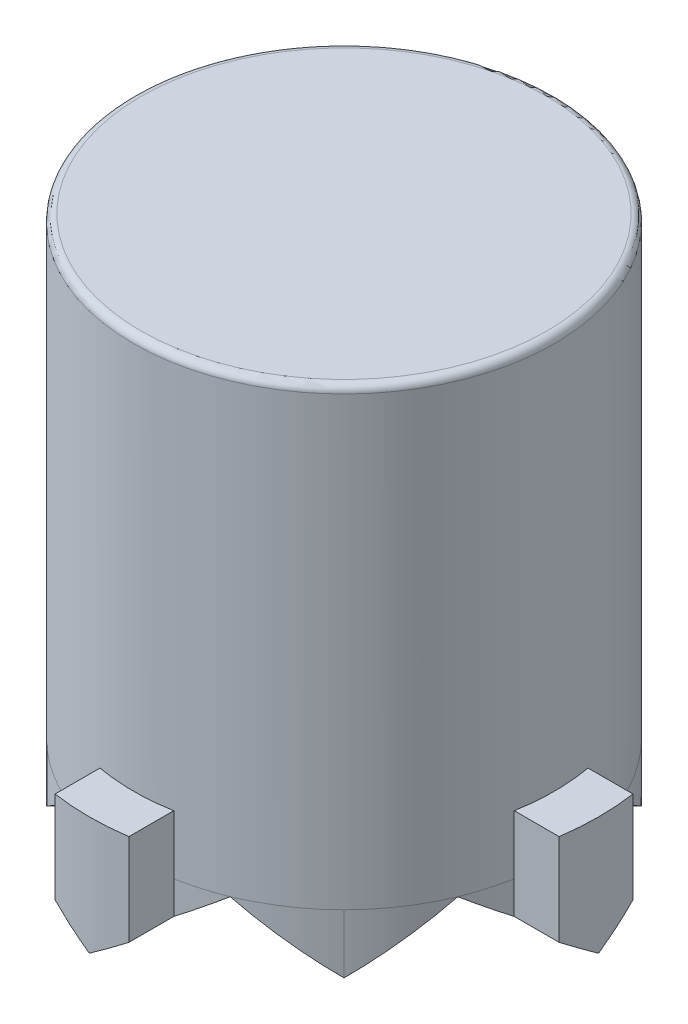
from build123d import *

# Parameters (mm, degrees)
CROQUIS1_R              = 2.85
SALIENTE_EXTRUIR1_DEPTH = 6.95
REDONDEO1_R             = 0.1
CROQUIS3_R              = 2.25
CORTAR_EXTRUIR1_DEPTH   = 4
CROQUIS20_R             = 2.85
CORTAR_EXTRUIR2_DEPTH   = 0.8
BARRER2_PITCH           = 12.8
BARRER2_HEIGHT          = 0.8
BARRER2_RADIUS          = 2.55
BARRER2_START_ANGLE     = -90
CROQUIS22_W             = 0.6
CROQUIS22_H             = 0.8
BARRER5_PITCH           = 12.8
BARRER5_HEIGHT          = 0.8
BARRER5_RADIUS          = 2.55
BARRER5_START_ANGLE     = -90
CROQUIS22_3_W           = 0.6
CROQUIS22_3_H           = 0.8
BARRER6_PITCH           = 12.8
BARRER6_HEIGHT          = 0.8
BARRER6_RADIUS          = 2.55
CROQUIS26_W             = 0.6
CROQUIS26_H             = 0.8
BARRER7_PITCH           = 12.8
BARRER7_HEIGHT          = 0.8
BARRER7_RADIUS          = 2.55
CROQUIS26_2_W           = 0.6
CROQUIS26_2_H           = 0.8
BARRER8_PITCH           = 12.8
BARRER8_HEIGHT          = 0.8
BARRER8_RADIUS          = 2.55
BARRER8_START_ANGLE     = -45
CROQUIS28_W             = 0.6
CROQUIS28_H             = 0.8
BARRER9_PITCH           = 12.8
BARRER9_HEIGHT          = 0.8
BARRER9_RADIUS          = 2.55
BARRER9_START_ANGLE     = -45
CROQUIS28_2_W           = 0.6
CROQUIS28_2_H           = 0.8
BARRER10_PITCH          = 12.8
BARRER10_HEIGHT         = 0.8
BARRER10_RADIUS         = 2.55
BARRER10_START_ANGLE    = 45
CROQUIS29_W             = 0.6
CROQUIS29_H             = 0.8
BARRER11_PITCH          = 12.8
BARRER11_HEIGHT         = 0.8
BARRER11_RADIUS         = 2.55
BARRER11_START_ANGLE    = 45
CROQUIS29_2_W           = 0.6
CROQUIS29_2_H           = 0.8
SALIENTE_EXTRUIR3_DEPTH = 1.6
CORTAR_EXTRUIR7_DEPTH   = 50
CORTAR_EXTRUIR8_DEPTH   = 50
CORTAR_EXTRUIR9_DEPTH   = 50
CORTAR_EXTRUIR10_DEPTH  = 50


with BuildPart() as part:
    # Croquis1 → Saliente-Extruir1 (new body)
    with BuildSketch(Plane(origin=(0, 0, 0), x_dir=(1, 0, 0), z_dir=(0, 1, 0))):
        with Locations(Location((0, 0, 0), (0, 0, 270))):
            Circle(CROQUIS1_R)
    extrude(amount=SALIENTE_EXTRUIR1_DEPTH)

    # Redondeo1
    redondeo1_edges = [part.edges().sort_by_distance(p)[0] for p in [
        (0, 6.95, -2.85),
    ]]
    fillet(redondeo1_edges, radius=REDONDEO1_R)

    # Croquis3 → Cortar-Extruir1 (cut)
    with BuildSketch(Plane.XZ):
        with Locations(Location((0, 0, 0), (0, 0, 270))):
            Circle(CROQUIS3_R)
    extrude(amount=-CORTAR_EXTRUIR1_DEPTH, mode=Mode.SUBTRACT)

    # Croquis20 → Cortar-Extruir2 (cut)
    with BuildSketch(Plane.XZ):
        with Locations(Location((0, 0, 0), (0, 0, 270))):
            Circle(CROQUIS20_R)
    extrude(amount=-CORTAR_EXTRUIR2_DEPTH, mode=Mode.SUBTRACT)

    # Barrer2: sweep along a helix
    with BuildLine() as barrer2_path:
        add(Helix(BARRER2_PITCH, BARRER2_HEIGHT, BARRER2_RADIUS, center=(0, 0, 0), direction=(0, 1, 0), mode=Mode.PRIVATE).rotate(Axis((0, 0, 0), (0, 1, 0)), BARRER2_START_ANGLE))
    # Croquis22 → Barrer2 (sweep)
    with BuildSketch(Plane.XY):
        with Locations((-2.55, 0.4)):
            Rectangle(CROQUIS22_W, CROQUIS22_H)
        with Locations((2.55, 0.4)):
            Rectangle(CROQUIS22_W, CROQUIS22_H)
    sweep(path=barrer2_path.line, is_frenet=True)

    # Barrer5: sweep along a helix
    with BuildLine() as barrer5_path:
        add(Helix(BARRER5_PITCH, BARRER5_HEIGHT, BARRER5_RADIUS, center=(0, 0, 0), direction=(0, 1, 0), lefthand=True, mode=Mode.PRIVATE).rotate(Axis((0, 0, 0), (0, 1, 0)), BARRER5_START_ANGLE))
    # Croquis22<3> → Barrer5 (sweep)
    with BuildSketch(Plane.XY):
        with Locations((-2.55, 0.4)):
            Rectangle(CROQUIS22_3_W, CROQUIS22_3_H)
        with Locations((2.55, 0.4)):
            Rectangle(CROQUIS22_3_W, CROQUIS22_3_H)
    sweep(path=barrer5_path.line, is_frenet=True)

    # Barrer6: sweep along a helix
    with BuildLine() as barrer6_path:
        Helix(BARRER6_PITCH, BARRER6_HEIGHT, BARRER6_RADIUS, center=(0, 0, 0), direction=(0, 1, 0), lefthand=True)
    # Croquis26 → Barrer6 (sweep)
    with BuildSketch(Plane(origin=(0, 0, 0), x_dir=(0, 0, -1), z_dir=(1, 0, 0))):
        with Locations((-2.55, 0.4)):
            Rectangle(CROQUIS26_W, CROQUIS26_H)
        with Locations((2.55, 0.4)):
            Rectangle(CROQUIS26_W, CROQUIS26_H)
    sweep(path=barrer6_path.line, is_frenet=True)

    # Barrer7: sweep along a helix
    with BuildLine() as barrer7_path:
        Helix(BARRER7_PITCH, BARRER7_HEIGHT, BARRER7_RADIUS, center=(0, 0, 0), direction=(0, 1, 0))
    # Croquis26<2> → Barrer7 (sweep)
    with BuildSketch(Plane(origin=(0, 0, 0), x_dir=(0, 0, -1), z_dir=(1, 0, 0))):
        with Locations((-2.55, 0.4)):
            Rectangle(CROQUIS26_2_W, CROQUIS26_2_H)
        with Locations((2.55, 0.4)):
            Rectangle(CROQUIS26_2_W, CROQUIS26_2_H)
    sweep(path=barrer7_path.line, is_frenet=True)

    # Barrer8: sweep along a helix
    with BuildLine() as barrer8_path:
        add(Helix(BARRER8_PITCH, BARRER8_HEIGHT, BARRER8_RADIUS, center=(0, 0, 0), direction=(0, 1, 0), mode=Mode.PRIVATE).rotate(Axis((0, 0, 0), (0, 1, 0)), BARRER8_START_ANGLE))
    # Croquis28 → Barrer8 (sweep)
    with BuildSketch(Plane(origin=(0, 0, 0), x_dir=(0.7071067811865537, 0, -0.7071067811865415), z_dir=(0.7071067811865415, 0, 0.7071067811865537))):
        with Locations((-2.55, 0.4)):
            Rectangle(CROQUIS28_W, CROQUIS28_H)
        with Locations((2.55, 0.4)):
            Rectangle(CROQUIS28_W, CROQUIS28_H)
    sweep(path=barrer8_path.line, is_frenet=True)

    # Barrer9: sweep along a helix
    with BuildLine() as barrer9_path:
        add(Helix(BARRER9_PITCH, BARRER9_HEIGHT, BARRER9_RADIUS, center=(0, 0, 0), direction=(0, 1, 0), lefthand=True, mode=Mode.PRIVATE).rotate(Axis((0, 0, 0), (0, 1, 0)), BARRER9_START_ANGLE))
    # Croquis28<2> → Barrer9 (sweep)
    with BuildSketch(Plane(origin=(0, 0, 0), x_dir=(0.7071067811865537, 0, -0.7071067811865415), z_dir=(0.7071067811865415, 0, 0.7071067811865537))):
        with Locations((-2.55, 0.4)):
            Rectangle(CROQUIS28_2_W, CROQUIS28_2_H)
        with Locations((2.55, 0.4)):
            Rectangle(CROQUIS28_2_W, CROQUIS28_2_H)
    sweep(path=barrer9_path.line, is_frenet=True)

    # Barrer10: sweep along a helix
    with BuildLine() as barrer10_path:
        add(Helix(BARRER10_PITCH, BARRER10_HEIGHT, BARRER10_RADIUS, center=(0, 0, 0), direction=(0, 1, 0), lefthand=True, mode=Mode.PRIVATE).rotate(Axis((0, 0, 0), (0, 1, 0)), BARRER10_START_ANGLE))
    # Croquis29 → Barrer10 (sweep)
    with BuildSketch(Plane(origin=(0, 0, 0), x_dir=(-0.707106781186544, 0, -0.7071067811865511), z_dir=(0.7071067811865511, 0, -0.707106781186544))):
        with Locations((-2.55, 0.4)):
            Rectangle(CROQUIS29_W, CROQUIS29_H)
        with Locations((2.55, 0.4)):
            Rectangle(CROQUIS29_W, CROQUIS29_H)
    sweep(path=barrer10_path.line, is_frenet=True)

    # Barrer11: sweep along a helix
    with BuildLine() as barrer11_path:
        add(Helix(BARRER11_PITCH, BARRER11_HEIGHT, BARRER11_RADIUS, center=(0, 0, 0), direction=(0, 1, 0), mode=Mode.PRIVATE).rotate(Axis((0, 0, 0), (0, 1, 0)), BARRER11_START_ANGLE))
    # Croquis29<2> → Barrer11 (sweep)
    with BuildSketch(Plane(origin=(0, 0, 0), x_dir=(-0.707106781186544, 0, -0.7071067811865511), z_dir=(0.7071067811865511, 0, -0.707106781186544))):
        with Locations((-2.55, 0.4)):
            Rectangle(CROQUIS29_2_W, CROQUIS29_2_H)
        with Locations((2.55, 0.4)):
            Rectangle(CROQUIS29_2_W, CROQUIS29_2_H)
    sweep(path=barrer11_path.line, is_frenet=True)


with BuildPart() as saliente_extruir3_tool:
    # Croquis35 → Saliente-Extruir3 (new body)
    with BuildSketch(Plane(origin=(0, 0, 0), x_dir=(1, 0, 0), z_dir=(0, 1, 0))):
        with BuildLine():
            Line((-3.413575838, -0.5), (-2.805797569, -0.5))
            ThreePointArc((-2.805797569, -0.5), (-2.85, 0), (-2.805797569, 0.5))
            Line((-2.805797569, 0.5), (-3.413575838, 0.5))
            ThreePointArc((-3.413575838, 0.5), (-3.45, 0), (-3.413575838, -0.5))
        make_face()
        with BuildLine():
            Line((-0.5, 3.413575838), (-0.5, 2.805797569))
            ThreePointArc((-0.5, 2.805797569), (0, 2.85), (0.5, 2.805797569))
            Line((0.5, 2.805797569), (0.5, 3.413575838))
            ThreePointArc((0.5, 3.413575838), (0, 3.45), (-0.5, 3.413575838))
        make_face()
        with BuildLine():
            Line((2.805797569, 0.5), (3.413575838, 0.5))
            ThreePointArc((3.413575838, 0.5), (3.45, 0), (3.413575838, -0.5))
            Line((3.413575838, -0.5), (2.805797569, -0.5))
            ThreePointArc((2.805797569, -0.5), (2.85, 0), (2.805797569, 0.5))
        make_face()
        with BuildLine():
            Line((-0.5, -2.805797569), (-0.5, -3.413575838))
            ThreePointArc((-0.5, -3.413575838), (0, -3.45), (0.5, -3.413575838))
            Line((0.5, -3.413575838), (0.5, -2.805797569))
            ThreePointArc((0.5, -2.805797569), (0, -2.85), (-0.5, -2.805797569))
        make_face()
    extrude(amount=SALIENTE_EXTRUIR3_DEPTH)


with BuildPart() as part_1:
    add(part.part)


with BuildPart() as part_2:
    # Saliente-Extruir3: joined with saliente_extruir3_tool
    add(part_1.part.fuse(saliente_extruir3_tool.part, tol=0.00001))

    # Croquis36 → Cortar-Extruir7 (cut, symmetric)
    with BuildSketch(Plane.XY):
        with BuildLine():
            Line((-0.5, 0), (0, 0))
            add(Edge.make_bspline(
                [(0, 0), (-0.069614769, 0.049458706), (-0.237545716, 0.168767402), (-0.403084392, 0.288929236), (-0.5, 0.359278701)],
                knots=[0, 0, 0, 0, 0.414544014, 1, 1, 1, 1], degree=3))
            Line((-0.5, 0.359278701), (-0.5, 0))
        make_face()
    extrude(amount=CORTAR_EXTRUIR7_DEPTH, both=True, mode=Mode.SUBTRACT)

    # Croquis37 → Cortar-Extruir8 (cut, symmetric)
    with BuildSketch(Plane.XY):
        with BuildLine():
            Line((0, 0), (0.5, 0))
            Line((0.5, 0), (0.5, 0.359278701))
            ThreePointArc((0.5, 0.359278701), (0.25065713, 0.178724837), (0, 0))
        make_face()
    extrude(amount=CORTAR_EXTRUIR8_DEPTH, both=True, mode=Mode.SUBTRACT)

    # Croquis38 → Cortar-Extruir9 (cut, symmetric)
    with BuildSketch(Plane(origin=(0, 0, 0), x_dir=(0, 0, -1), z_dir=(1, 0, 0))):
        with BuildLine():
            Line((-0.5, 0.359278701), (-0.5, 0))
            Line((-0.5, 0), (0, 0))
            ThreePointArc((0, 0), (-0.25065713, 0.178724837), (-0.5, 0.359278701))
        make_face()
    extrude(amount=CORTAR_EXTRUIR9_DEPTH, both=True, mode=Mode.SUBTRACT)

    # Croquis39 → Cortar-Extruir10 (cut, symmetric)
    with BuildSketch(Plane(origin=(0, 0, 0), x_dir=(0, 0, -1), z_dir=(1, 0, 0))):
        with BuildLine():
            Line((0.5, 0), (0.5, 0.359278701))
            ThreePointArc((0.5, 0.359278701), (0.25065713, 0.178724837), (0, 0))
            Line((0, 0), (0.5, 0))
        make_face()
    extrude(amount=CORTAR_EXTRUIR10_DEPTH, both=True, mode=Mode.SUBTRACT)


solid = part_2.part
